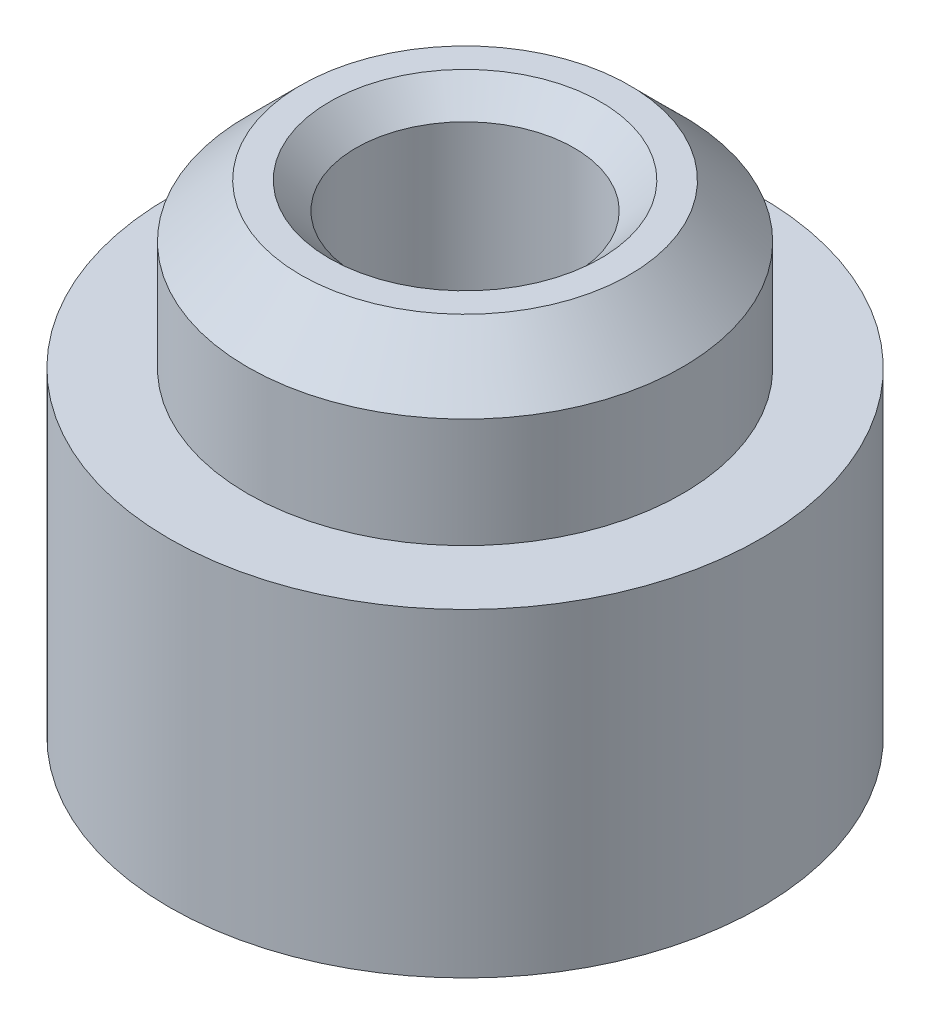
from build123d import *

# Parameters (mm, degrees)
SKETCH_1_R                     = 2.045
EXTRUDE_1_DEPTH                = 1.53
SKETCH_1_4_R                   = 2.78
EXTRUDE_2_DEPTH                = 3
CHAMFER_1_SIZE                 = 0.5
HOLE_WIZARD_M2_5_3_D           = 2.05
HOLE_WIZARD_M2_5_3_CSINK_D     = 2.55
HOLE_WIZARD_M2_5_3_CSINK_ANGLE = 90


with BuildPart() as part:
    # 草图1 → 凸台-拉伸1 (new body)
    with BuildSketch(Plane(origin=(0, 0, 0), x_dir=(1, 0, 0), z_dir=(0, 1, 0))):
        Circle(SKETCH_1_R)
    extrude(amount=EXTRUDE_1_DEPTH)

    # 草图1<4> → 凸台-拉伸2 (add)
    with BuildSketch(Plane(origin=(0, 0, 0), x_dir=(1, 0, 0), z_dir=(0, 1, 0))):
        Circle(SKETCH_1_4_R)
    extrude(amount=-EXTRUDE_2_DEPTH)

    # Chamfer 1
    chamfer_1_edges = [part.edges().sort_by_distance(p)[0] for p in [
        (-2.045, 1.53, 0),
    ]]
    chamfer(chamfer_1_edges, length=CHAMFER_1_SIZE)

    # M2.5 螺纹孔3 (through all)
    with Locations(Plane(origin=(0, 1.53, 0), x_dir=(1, 0, 0), z_dir=(0, 1, 0))):
        with Locations((0, 0)):
            CounterSinkHole(HOLE_WIZARD_M2_5_3_D / 2, HOLE_WIZARD_M2_5_3_CSINK_D / 2, counter_sink_angle=HOLE_WIZARD_M2_5_3_CSINK_ANGLE)


solid = part.part
